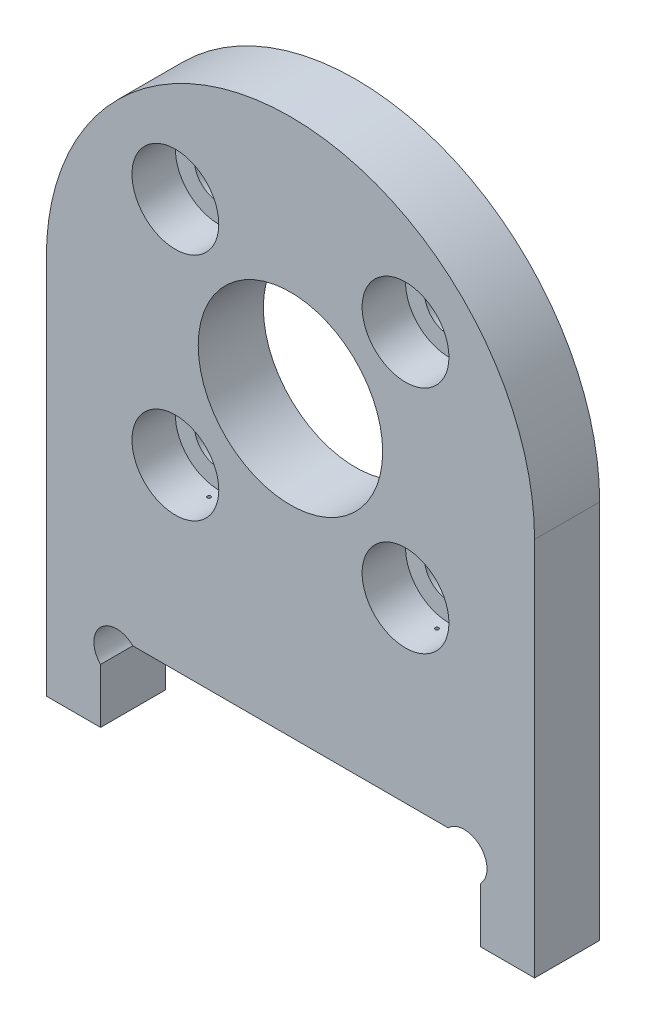
from build123d import *

# Parameters (mm, degrees)
EXTRUDE_1_DEPTH             = 6
SKETCH_2_R                  = 8.5
CUT_EXTRUDE_1_DEPTH         = 74.261517866
HOLE_WIZARD_M41_D           = 4.5
HOLE_WIZARD_M41_CBORE_D     = 8
HOLE_WIZARD_M41_CBORE_DEPTH = 4
SKETCH_6_W                  = 35
SKETCH_6_H                  = 16
CUT_EXTRUDE_2_DEPTH         = 10
M4X0_71_D                   = 3.3
M4X0_71_DEPTH               = 11.5
M4X0_71_TIP                 = 0.991420021
SKETCH_10_R                 = 2.1
CUT_EXTRUDE_3_DEPTH         = 74.261517866


with BuildPart() as part:
    # Эскиз1 → Бобышка-Вытянуть1 (new body)
    with BuildSketch(Plane.XY):
        with BuildLine():
            Line((0, 35), (0, 0))
            Line((0, 0), (45, 0))
            Line((45, 0), (45, 35))
            ThreePointArc((45, 35), (22.5, 57.5), (0, 35))
        make_face()
    extrude(amount=EXTRUDE_1_DEPTH)

    # Эскиз2 → Вырез-Вытянуть1 (cut, through all)
    with BuildSketch(Plane.XY.offset(6)):
        with Locations((22.5, 35)):
            Circle(SKETCH_2_R)
    extrude(amount=-CUT_EXTRUDE_1_DEPTH, mode=Mode.SUBTRACT)

    # Цековка для винта с внутренним шестигранником M41 (through all)
    with Locations(Plane.XY.offset(6)):
        with Locations((11.893398282, 45.606601718), (33.106601718, 45.606601718), (33.106601718, 24.393398282), (11.893398282, 24.393398282)):
            CounterBoreHole(HOLE_WIZARD_M41_D / 2, HOLE_WIZARD_M41_CBORE_D / 2, HOLE_WIZARD_M41_CBORE_DEPTH)

    # Эскиз6 → Вырез-Вытянуть2 (cut)
    with BuildSketch(Plane.XY.offset(6)):
        with Locations((22.5, 0)):
            Rectangle(SKETCH_6_W, SKETCH_6_H)
    extrude(amount=-CUT_EXTRUDE_2_DEPTH, mode=Mode.SUBTRACT)

    # Отверстие обработанное метчиком M4x0.71
    with Locations(Plane(origin=(0, 8, 0), x_dir=(-1, 0, 0), z_dir=(0, -1, 0))):
        with Locations((-12, -3), (-33, -3)):
            Hole(M4X0_71_D / 2, depth=M4X0_71_DEPTH)
            with Locations((0, 0, -(M4X0_71_DEPTH + M4X0_71_TIP / 2))):  # 118° drill point
                Cone(0, M4X0_71_D / 2, M4X0_71_TIP, mode=Mode.SUBTRACT)

    # Эскиз10 → Вырез-Вытянуть3 (cut, through all)
    with BuildSketch(Plane.XY.offset(6)):
        with Locations((6.48492424, 6.51507576)):
            Circle(SKETCH_10_R)
        with Locations((38.51507576, 6.51507576)):
            Circle(SKETCH_10_R)
    extrude(amount=-CUT_EXTRUDE_3_DEPTH, mode=Mode.SUBTRACT)


solid = part.part
